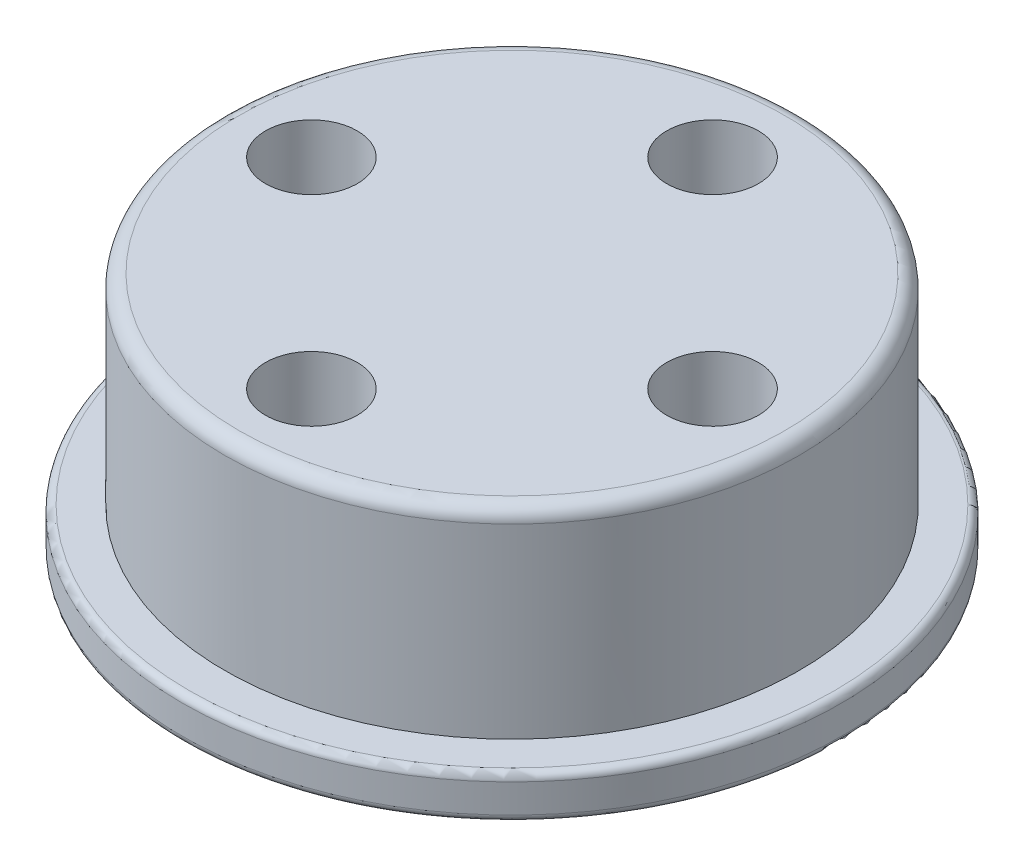
from build123d import *

# Parameters (mm, degrees)
SKETCH2_R                                       = 1.6
CUT_EXTRUDE1_DEPTH                              = 19.350749304
CSK_FOR_M3_FLAT_HEAD_MACHINE_SCREW1_D           = 2.8
CSK_FOR_M3_FLAT_HEAD_MACHINE_SCREW1_CSINK_D     = 6.5
CSK_FOR_M3_FLAT_HEAD_MACHINE_SCREW1_CSINK_ANGLE = 90
FILLET1_R                                       = 0.5
FILLET2_R                                       = 0.25


with BuildPart() as part:
    # Sketch1 → Revolve1 (revolve)
    with BuildSketch(Plane.XY):
        Polygon((0, 8.5), (10.025, 8.5), (10.025, 1.5), (11.5, 1.5), (11.5, 0), (0, 0), align=None)
    revolve(axis=Axis((0, 0, 0), (0, 1, 0)))

    # Sketch2 → Cut-Extrude1 (cut, through all)
    with BuildSketch(Plane.XZ):
        with Locations((0, 7)):
            Circle(SKETCH2_R)
        with Locations((7, 0)):
            Circle(SKETCH2_R)
        with Locations((0, -7)):
            Circle(SKETCH2_R)
        with Locations((-7, 0)):
            Circle(SKETCH2_R)
    extrude(amount=-CUT_EXTRUDE1_DEPTH, mode=Mode.SUBTRACT)

    # CSK for M3 Flat Head Machine Screw1 (through all)
    with Locations(Plane(origin=(0, 0, 7), x_dir=(0, 0, -1), z_dir=(0, -1, 0))):
        with Locations((0, 0), (7, 7), (14, 0), (7, -7)):
            CounterSinkHole(CSK_FOR_M3_FLAT_HEAD_MACHINE_SCREW1_D / 2, CSK_FOR_M3_FLAT_HEAD_MACHINE_SCREW1_CSINK_D / 2, counter_sink_angle=CSK_FOR_M3_FLAT_HEAD_MACHINE_SCREW1_CSINK_ANGLE)

    # Fillet1
    fillet1_edges = [part.edges().sort_by_distance(p)[0] for p in [
        (-10.025, 8.5, 0),
    ]]
    fillet(fillet1_edges, radius=FILLET1_R)

    # Fillet2
    fillet2_edges = [part.edges().sort_by_distance(p)[0] for p in [
        (-11.5, 0, 0),
        (-11.5, 1.5, 0),
    ]]
    fillet(fillet2_edges, radius=FILLET2_R)


solid = part.part
